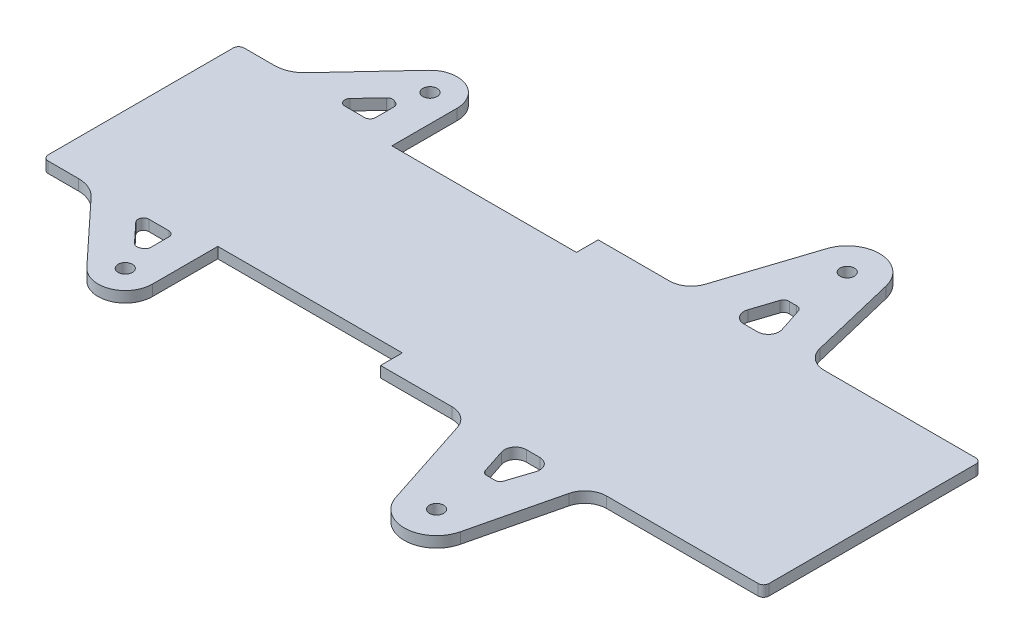
from build123d import *

# Parameters (mm, degrees)
SKETCH1_R           = 2.0828
BOSS_EXTRUDE1_DEPTH = 3.175
FILLET1_R           = 1.5875
FILLET2_R           = 3.175
FILLET3_R           = 1.5875
FILLET4_R           = 6.35
FILLET5_R           = 8.89
FILLET6_R           = 1.5875
FILLET7_R           = 1.5875
FILLET8_R           = 1.5875


with BuildPart() as part:
    # Sketch1 → Boss-Extrude1 (new body)
    with BuildSketch(Plane(origin=(0, 0, 0), x_dir=(1, 0, 0), z_dir=(0, 1, 0))):
        with BuildLine():
            Line((26.924, -25.4), (-26.924, -25.4))
            Line((-26.924, -25.4), (-26.924, -44.45))
            ThreePointArc((-26.924, -44.45), (-31.952659905, -51.835293193), (-40.667006123, -49.862947894))
            Line((-40.667006123, -49.862947894), (-60.5155, -28.575))
            Line((-60.5155, -28.575), (-74.803, -28.575))
            Line((-74.803, -28.575), (-74.803, 28.575))
            Line((-74.803, 28.575), (-60.5155, 28.575))
            Line((-60.5155, 28.575), (-40.667006123, 49.862947894))
            ThreePointArc((-40.667006123, 49.862947894), (-31.952659905, 51.835293193), (-26.924, 44.45))
            Line((-26.924, 44.45), (-26.924, 28.575))
            Line((-26.924, 28.575), (-26.924, 25.4))
            Line((-26.924, 25.4), (26.924, 25.4))
            Line((26.924, 25.4), (26.924, 31.75))
            Line((26.924, 31.75), (52.324, 31.75))
            Line((52.324, 31.75), (62.607581289, 63.240132856))
            ThreePointArc((62.607581289, 63.240132856), (72.010560326, 69.32064995), (80.585058538, 62.118797179))
            Line((80.585058538, 62.118797179), (87.884, 31.75))
            Line((87.884, 31.75), (138.684, 31.75))
            Line((138.684, 31.75), (138.684, -31.75))
            Line((138.684, -31.75), (87.884, -31.75))
            Line((87.884, -31.75), (80.585058538, -62.118797179))
            ThreePointArc((80.585058538, -62.118797179), (72.010560326, -69.32064995), (62.607581289, -63.240132856))
            Line((62.607581289, -63.240132856), (52.324, -31.75))
            Line((52.324, -31.75), (26.924, -31.75))
            Line((26.924, -31.75), (26.924, -25.4))
        make_face()
        with Locations((71.4240126, 59.9169998)):
            Circle(SKETCH1_R, mode=Mode.SUBTRACT)
        with Locations((-34.8615, 44.45)):
            Circle(SKETCH1_R, mode=Mode.SUBTRACT)
        with Locations((71.4240126, -59.9169998)):
            Circle(SKETCH1_R, mode=Mode.SUBTRACT)
        with Locations((-34.8615, -44.45)):
            Circle(SKETCH1_R, mode=Mode.SUBTRACT)
        with BuildLine():
            Line((-47.492572128, -28.575), (-39.003982914, -37.679199341))
            ThreePointArc((-39.003982914, -37.679199341), (-37.770340095, -37.064706807), (-36.449, -36.672870067))
            Line((-36.449, -36.672870067), (-36.449, -28.575))
            Line((-36.449, -28.575), (-47.492572128, -28.575))
        make_face(mode=Mode.SUBTRACT)
        with BuildLine():
            Line((77.7740126, 31.75), (65.0740126, 31.75))
            Line((65.0740126, 31.75), (69.141994412, 44.206875103))
            ThreePointArc((69.141994412, 44.206875103), (71.4240126, 44.0419998), (73.706030788, 44.206875103))
            Line((73.706030788, 44.206875103), (77.7740126, 31.75))
        make_face(mode=Mode.SUBTRACT)
        with BuildLine():
            Line((77.7740126, -31.75), (73.706030788, -44.206875103))
            ThreePointArc((73.706030788, -44.206875103), (71.4240126, -44.0419998), (69.141994412, -44.206875103))
            Line((69.141994412, -44.206875103), (65.0740126, -31.75))
            Line((65.0740126, -31.75), (77.7740126, -31.75))
        make_face(mode=Mode.SUBTRACT)
        with BuildLine():
            Line((-47.492572128, 28.575), (-36.449, 28.575))
            Line((-36.449, 28.575), (-36.449, 36.672870067))
            ThreePointArc((-36.449, 36.672870067), (-37.770340095, 37.064706807), (-39.003982914, 37.679199341))
            Line((-39.003982914, 37.679199341), (-47.492572128, 28.575))
        make_face(mode=Mode.SUBTRACT)
    extrude(amount=BOSS_EXTRUDE1_DEPTH)

    # Fillet1
    fillet1_edges = [part.edges().sort_by_distance(p)[0] for p in [
        (73.706030788, 1.5875, -44.206875103),
        (69.141994412, 1.5875, -44.206875103),
        (73.706030788, 1.5875, 44.206875103),
        (69.141994412, 1.5875, 44.206875103),
    ]]
    fillet(fillet1_edges, radius=FILLET1_R)

    # Fillet2
    fillet2_edges = [part.edges().sort_by_distance(p)[0] for p in [
        (77.7740126, 1.5875, 31.75),
        (65.0740126, 1.5875, 31.75),
        (77.7740126, 1.5875, -31.75),
        (65.0740126, 1.5875, -31.75),
    ]]
    fillet(fillet2_edges, radius=FILLET2_R)

    # Fillet3
    fillet3_edges = [part.edges().sort_by_distance(p)[0] for p in [
        (138.684, 1.5875, -31.75),
        (138.684, 1.5875, 31.75),
    ]]
    fillet(fillet3_edges, radius=FILLET3_R)

    # Fillet4
    fillet4_edges = [part.edges().sort_by_distance(p)[0] for p in [
        (52.324, 1.5875, -31.75),
        (87.884, 1.5875, -31.75),
        (87.884, 1.5875, 31.75),
        (52.324, 1.5875, 31.75),
    ]]
    fillet(fillet4_edges, radius=FILLET4_R)

    # Fillet5
    fillet5_edges = [part.edges().sort_by_distance(p)[0] for p in [
        (-60.5155, 1.5875, -28.575),
        (-60.5155, 1.5875, 28.575),
    ]]
    fillet(fillet5_edges, radius=FILLET5_R)

    # Fillet6
    fillet6_edges = [part.edges().sort_by_distance(p)[0] for p in [
        (-74.803, 1.5875, 28.575),
        (-74.803, 1.5875, -28.575),
    ]]
    fillet(fillet6_edges, radius=FILLET6_R)

    # Fillet7
    fillet7_edges = [part.edges().sort_by_distance(p)[0] for p in [
        (-36.449, 1.5875, -28.575),
        (-36.449, 1.5875, 28.575),
    ]]
    fillet(fillet7_edges, radius=FILLET7_R)

    # Fillet8
    fillet8_edges = [part.edges().sort_by_distance(p)[0] for p in [
        (-36.449, 1.5875, 36.672870067),
        (-39.003982914, 1.5875, 37.679199341),
        (-47.492572128, 1.5875, 28.575),
        (-36.449, 1.5875, -36.672870067),
        (-39.003982914, 1.5875, -37.679199341),
        (-47.492572128, 1.5875, -28.575),
    ]]
    fillet(fillet8_edges, radius=FILLET8_R)


solid = part.part
